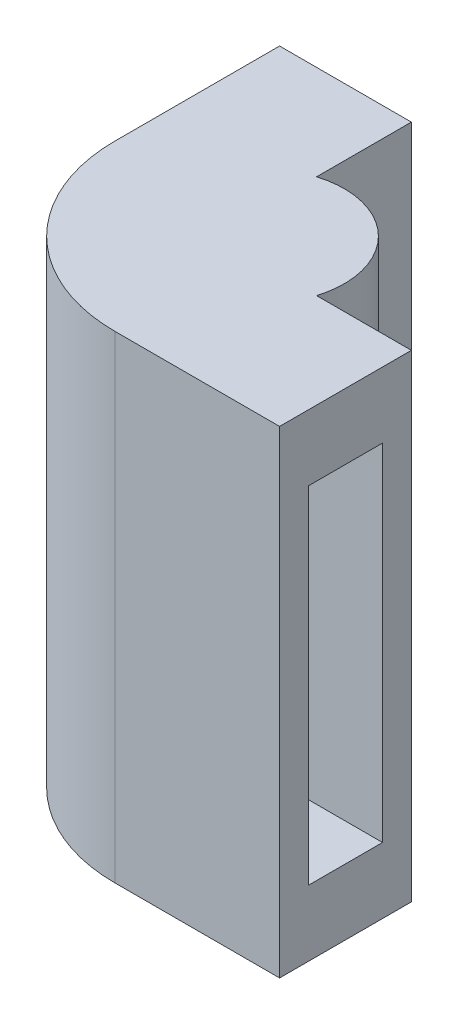
from build123d import *

# Parameters (mm, degrees)
BOSS_EXTRUDE1_DEPTH = 29
SKETCH3_W           = 4.5
SKETCH3_H           = 21
CUT_EXTRUDE1_DEPTH  = 6


with BuildPart() as part:
    # Sketch2 → Boss-Extrude1 (new body)
    with BuildSketch(Plane(origin=(0, 0, 0), x_dir=(1, 0, 0), z_dir=(0, 1, 0))):
        with BuildLine():
            Line((0, 10), (0, 20))
            Line((0, 20), (8, 20))
            Line((8, 20), (8, 14.245191882))
            ThreePointArc((8, 14.245191882), (10.672752557, 14.316274399), (13, 13))
            Line((13, 13), (9.464466094, 9.464466094))
            Line((9.464466094, 9.464466094), (2.928932188, 2.928932188))
            ThreePointArc((2.928932188, 2.928932188), (0.761204675, 6.173165676), (0, 10))
        make_face()
    boss_extrude1 = extrude(amount=BOSS_EXTRUDE1_DEPTH)

    # Mirror1: Boss-Extrude1 across plane
    add(boss_extrude1.mirror(Plane(origin=(0, 0, 0), x_dir=(-0.707106781186546, 0, 0.707106781186549), z_dir=(0.707106781186549, 0, 0.707106781186546))))

    # Sketch3 → Cut-Extrude1 (cut)
    with BuildSketch(Plane(origin=(0, 0, -20), x_dir=(-1, 0, 0), z_dir=(0, 0, -1))):
        with Locations((-4, 14.5)):
            Rectangle(SKETCH3_W, SKETCH3_H)
    cut_extrude1 = extrude(amount=-CUT_EXTRUDE1_DEPTH, mode=Mode.SUBTRACT)

    # Mirror2: Cut-Extrude1 across plane
    add(cut_extrude1.mirror(Plane(origin=(0, 0, 0), x_dir=(-0.707106781186546, 0, 0.707106781186549), z_dir=(0.707106781186549, 0, 0.707106781186546))), mode=Mode.SUBTRACT)


solid = part.part
